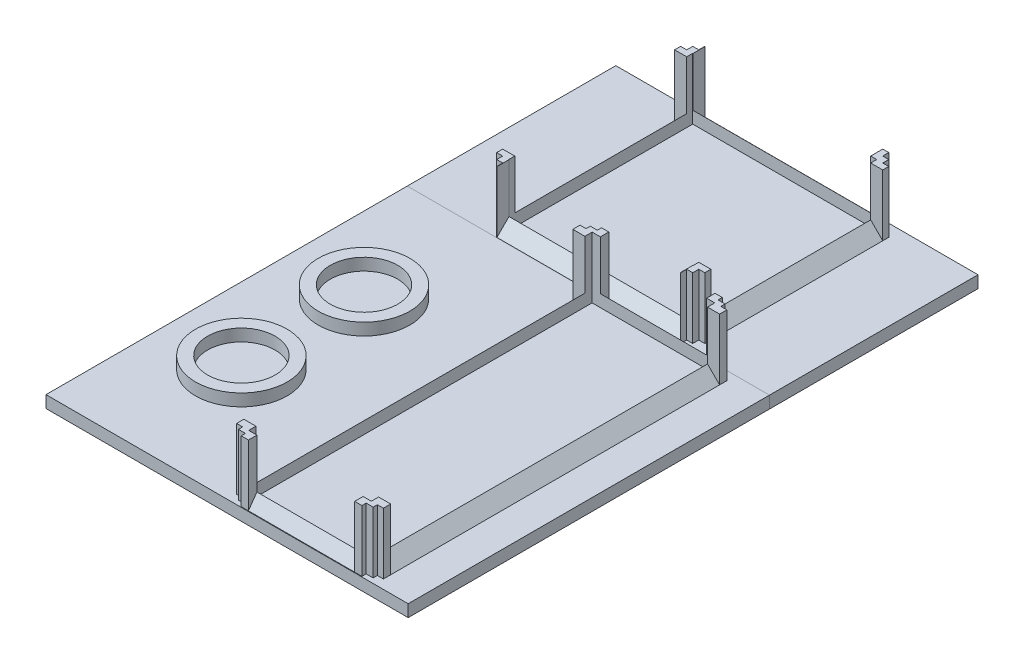
from build123d import *

# Parameters (mm, degrees)
OUTLINE_W                    = 75
OUTLINE_H                    = 236
THE_FLOOR_DEPTH              = 5
CABINET_SIDE_RESTRAINT_DEPTH = 76.2
BOSS_EXTRUDE7_DEPTH          = 38
BOSS_EXTRUDE15_DEPTH         = 25.4
SIDE_RESTRAINTS_DEPTH        = 71.12
SKETCH17_W                   = 5
SKETCH17_H                   = 5
BOSS_EXTRUDE16_DEPTH         = 25
BOSS_EXTRUDE17_REACH         = 144.106
SKETCH24_W                   = 5
SKETCH24_H                   = 3
SKETCH24_W_2                 = 3
SKETCH24_H_2                 = 3.5


# Read off the part's stored shape, not the designer's step: Boss-Extrude15
with BuildPart() as part:
    # outline → the floor (new body)
    with BuildSketch(Plane(origin=(0, 0, 0), x_dir=(1, 0, 0), z_dir=(0, 1, 0))):
        with Locations((37.5, 0)):
            Rectangle(OUTLINE_W, OUTLINE_H)
        with Locations((-37.5, 0)):
            Rectangle(OUTLINE_W, OUTLINE_H)
    extrude(amount=THE_FLOOR_DEPTH)

    # Sketch7 → cabinet side restraint (add)
    with BuildSketch(Plane.XY.offset(-36.75)):
        Polygon((-38.1, 5), (-38.1, 10), (-43.1, 5), align=None)
    cabinet_side_restraint = extrude(amount=-CABINET_SIDE_RESTRAINT_DEPTH)

    # Mirror1: cabinet side restraint across plane
    add(cabinet_side_restraint.mirror(Plane(origin=(0, 0, 0), x_dir=(0, 0, 1), z_dir=(1, 0, 0))))

    # Sketch9 → Boss-Extrude7 (add, symmetric)
    with BuildSketch(Plane(origin=(0, 0, 0), x_dir=(0, 0, -1), z_dir=(1, 0, 0))):
        Polygon((112.95, 5), (117.95, 5), (112.95, 10), align=None)
    boss_extrude7 = extrude(amount=BOSS_EXTRUDE7_DEPTH, both=True)

    # Mirror2: Boss-Extrude7 across plane
    add(boss_extrude7.mirror(Plane.XY.offset(-74.85)))

    # Boss-Extrude15 outline → Boss-Extrude15 (add)
    with BuildSketch(Plane(origin=(0, 5, 0), x_dir=(1, 0, 0), z_dir=(0, 1, 0))):
        Polygon((38.1, 112.95), (38.1, 110.45), (43.1, 110.45), (43.1, 112.95), (40.6, 112.95), (40.6, 115.45), (38.1, 115.45), (38.1, 117.95), (35.6, 117.95), (35.6, 112.95), align=None)
        Polygon((43.1, 39.25), (38.1, 39.25), (38.1, 36.75), (38, 36.75), (38, 31.75), (38.1, 31.75), (38.1, 34.25), (40.6, 34.25), (40.6, 36.75), (43.1, 36.75), align=None)
        Polygon((-38.1, 112.95), (-38, 112.95), (-38, 117.95), (-38.1, 117.95), (-38.1, 115.45), (-40.6, 115.45), (-40.6, 112.95), (-43.1, 112.95), (-43.1, 110.45), (-38.1, 110.45), align=None)
        Polygon((-38, 31.75), (-38, 36.75), (-38.1, 36.75), (-38.1, 39.25), (-43.1, 39.25), (-43.1, 36.75), (-40.6, 36.75), (-40.6, 34.25), (-38.1, 34.25), (-38.1, 31.75), align=None)
    extrude(amount=BOSS_EXTRUDE15_DEPTH)

    # Sketch12 → side restraints (add, symmetric)
    with BuildSketch(Plane.XY.offset(43.13)):
        Polygon((0.197497467, 5), (5.197497467, 5), (5.197497467, 10), align=None)
    side_restraints = extrude(amount=SIDE_RESTRAINTS_DEPTH, both=True)

    # restraint mirror: side restraints across plane
    add(side_restraints.mirror(Plane(origin=(30.597497467, 0, 0), x_dir=(0, 0, 1), z_dir=(1, 0, 0))))

    # Sketch17 → Revolve1 (revolve)
    with BuildSketch(Plane.XY.offset(17.73), mode=Mode.PRIVATE) as revolve1_sk:
        with Locations((-60.023321963, 7.5)):
            Rectangle(SKETCH17_W, SKETCH17_H)
    revolve1 = revolve(revolve1_sk.sketch.rotate(Axis((-43.553321963, 5, 17.73), (0, 1, 0)), 270), axis=Axis((-43.553321963, 5, 17.73), (0, 1, 0)))

    # Mirror7: Revolve1 across plane
    add(revolve1.mirror(Plane.XY.offset(43.13)))

    # Sketch23 → Boss-Extrude16 (add, symmetric)
    with BuildSketch(Plane(origin=(30.597497467, 0, 0), x_dir=(0, 0, -1), z_dir=(1, 0, 0))):
        Polygon((27.99, 5), (27.99, 10), (31.49, 5), align=None)
    boss_extrude16 = extrude(amount=BOSS_EXTRUDE16_DEPTH, both=True)

    # Mirror10: Boss-Extrude16 across plane
    add(boss_extrude16.mirror(Plane.XY.offset(43.13)))

    # Boss-Extrude17: up to this face of the body (flat: up to its plane)
    boss_extrude17_end = Plane(part.part.faces().sort_by_distance((-40.127922078, 30.4, -37.090909091))[0])
    # Sketch24 → Boss-Extrude17 (add, up to the picked face)
    with BuildSketch(Plane(origin=(0, 5, 0), x_dir=(1, 0, 0), z_dir=(0, 1, 0)), mode=Mode.PRIVATE) as boss_extrude17_sk1:
        with Locations((2.697497467, 26.49)):
            Rectangle(SKETCH24_W, SKETCH24_H)
    boss_extrude17_tool1 = split(extrude(boss_extrude17_sk1.sketch, amount=BOSS_EXTRUDE17_REACH, mode=Mode.PRIVATE), bisect_by=boss_extrude17_end, keep=Keep.BOTH, mode=Mode.PRIVATE)
    # Sketch24 → Boss-Extrude17 (add, up to the picked face)
    with BuildSketch(Plane(origin=(0, 5, 0), x_dir=(1, 0, 0), z_dir=(0, 1, 0)), mode=Mode.PRIVATE) as boss_extrude17_sk2:
        Polygon((5.597497467, 27.99), (5.597497467, 29.74), (2.697497467, 29.74), (2.697497467, 27.99), (5.197497467, 27.99), align=None)
    boss_extrude17_tool2 = split(extrude(boss_extrude17_sk2.sketch, amount=BOSS_EXTRUDE17_REACH, mode=Mode.PRIVATE), bisect_by=boss_extrude17_end, keep=Keep.BOTH, mode=Mode.PRIVATE)
    # Sketch24 → Boss-Extrude17 (add, up to the picked face)
    with BuildSketch(Plane(origin=(0, 5, 0), x_dir=(1, 0, 0), z_dir=(0, 1, 0)), mode=Mode.PRIVATE) as boss_extrude17_sk3:
        with Locations((7.097497467, 29.74)):
            Rectangle(SKETCH24_W_2, SKETCH24_H_2)
    boss_extrude17_tool3 = split(extrude(boss_extrude17_sk3.sketch, amount=BOSS_EXTRUDE17_REACH, mode=Mode.PRIVATE), bisect_by=boss_extrude17_end, keep=Keep.BOTH, mode=Mode.PRIVATE)
    # Sketch24 → Boss-Extrude17 (add, up to the picked face)
    with BuildSketch(Plane(origin=(0, 5, 0), x_dir=(1, 0, 0), z_dir=(0, 1, 0)), mode=Mode.PRIVATE) as boss_extrude17_sk4:
        with Locations((54.097497467, 29.74)):
            Rectangle(SKETCH24_W_2, SKETCH24_H_2)
    boss_extrude17_tool4 = split(extrude(boss_extrude17_sk4.sketch, amount=BOSS_EXTRUDE17_REACH, mode=Mode.PRIVATE), bisect_by=boss_extrude17_end, keep=Keep.BOTH, mode=Mode.PRIVATE)
    # Sketch24 → Boss-Extrude17 (add, up to the picked face)
    with BuildSketch(Plane(origin=(0, 5, 0), x_dir=(1, 0, 0), z_dir=(0, 1, 0)), mode=Mode.PRIVATE) as boss_extrude17_sk5:
        Polygon((55.597497467, 29.74), (55.597497467, 27.99), (55.997497467, 27.99), (58.497497467, 27.99), (58.497497467, 29.74), align=None)
    boss_extrude17_tool5 = split(extrude(boss_extrude17_sk5.sketch, amount=BOSS_EXTRUDE17_REACH, mode=Mode.PRIVATE), bisect_by=boss_extrude17_end, keep=Keep.BOTH, mode=Mode.PRIVATE)
    # Sketch24 → Boss-Extrude17 (add, up to the picked face)
    with BuildSketch(Plane(origin=(0, 5, 0), x_dir=(1, 0, 0), z_dir=(0, 1, 0)), mode=Mode.PRIVATE) as boss_extrude17_sk6:
        with Locations((58.497497467, 26.49)):
            Rectangle(SKETCH24_W, SKETCH24_H)
    boss_extrude17_tool6 = split(extrude(boss_extrude17_sk6.sketch, amount=BOSS_EXTRUDE17_REACH, mode=Mode.PRIVATE), bisect_by=boss_extrude17_end, keep=Keep.BOTH, mode=Mode.PRIVATE)
    # Sketch24 → Boss-Extrude17 (add, up to the picked face)
    with BuildSketch(Plane(origin=(0, 5, 0), x_dir=(1, 0, 0), z_dir=(0, 1, 0)), mode=Mode.PRIVATE) as boss_extrude17_sk7:
        with Locations((58.497497467, -112.75)):
            Rectangle(SKETCH24_W, SKETCH24_H)
    boss_extrude17_tool7 = split(extrude(boss_extrude17_sk7.sketch, amount=BOSS_EXTRUDE17_REACH, mode=Mode.PRIVATE), bisect_by=boss_extrude17_end, keep=Keep.BOTH, mode=Mode.PRIVATE)
    # Sketch24 → Boss-Extrude17 (add, up to the picked face)
    with BuildSketch(Plane(origin=(0, 5, 0), x_dir=(1, 0, 0), z_dir=(0, 1, 0)), mode=Mode.PRIVATE) as boss_extrude17_sk8:
        Polygon((55.997497467, -114.25), (55.597497467, -114.25), (55.597497467, -116), (58.497497467, -116), (58.497497467, -114.25), align=None)
    boss_extrude17_tool8 = split(extrude(boss_extrude17_sk8.sketch, amount=BOSS_EXTRUDE17_REACH, mode=Mode.PRIVATE), bisect_by=boss_extrude17_end, keep=Keep.BOTH, mode=Mode.PRIVATE)
    # Sketch24 → Boss-Extrude17 (add, up to the picked face)
    with BuildSketch(Plane(origin=(0, 5, 0), x_dir=(1, 0, 0), z_dir=(0, 1, 0)), mode=Mode.PRIVATE) as boss_extrude17_sk9:
        with Locations((54.097497467, -116)):
            Rectangle(SKETCH24_W_2, SKETCH24_H_2)
    boss_extrude17_tool9 = split(extrude(boss_extrude17_sk9.sketch, amount=BOSS_EXTRUDE17_REACH, mode=Mode.PRIVATE), bisect_by=boss_extrude17_end, keep=Keep.BOTH, mode=Mode.PRIVATE)
    # Sketch24 → Boss-Extrude17 (add, up to the picked face)
    with BuildSketch(Plane(origin=(0, 5, 0), x_dir=(1, 0, 0), z_dir=(0, 1, 0)), mode=Mode.PRIVATE) as boss_extrude17_sk10:
        with Locations((7.097497467, -116)):
            Rectangle(SKETCH24_W_2, SKETCH24_H_2)
    boss_extrude17_tool10 = split(extrude(boss_extrude17_sk10.sketch, amount=BOSS_EXTRUDE17_REACH, mode=Mode.PRIVATE), bisect_by=boss_extrude17_end, keep=Keep.BOTH, mode=Mode.PRIVATE)
    # Sketch24 → Boss-Extrude17 (add, up to the picked face)
    with BuildSketch(Plane(origin=(0, 5, 0), x_dir=(1, 0, 0), z_dir=(0, 1, 0)), mode=Mode.PRIVATE) as boss_extrude17_sk11:
        Polygon((5.597497467, -116), (5.597497467, -114.25), (5.197497467, -114.25), (2.697497467, -114.25), (2.697497467, -116), align=None)
    boss_extrude17_tool11 = split(extrude(boss_extrude17_sk11.sketch, amount=BOSS_EXTRUDE17_REACH, mode=Mode.PRIVATE), bisect_by=boss_extrude17_end, keep=Keep.BOTH, mode=Mode.PRIVATE)
    # Sketch24 → Boss-Extrude17 (add, up to the picked face)
    with BuildSketch(Plane(origin=(0, 5, 0), x_dir=(1, 0, 0), z_dir=(0, 1, 0)), mode=Mode.PRIVATE) as boss_extrude17_sk12:
        with Locations((2.697497467, -112.75)):
            Rectangle(SKETCH24_W, SKETCH24_H)
    boss_extrude17_tool12 = split(extrude(boss_extrude17_sk12.sketch, amount=BOSS_EXTRUDE17_REACH, mode=Mode.PRIVATE), bisect_by=boss_extrude17_end, keep=Keep.BOTH, mode=Mode.PRIVATE)
    add(boss_extrude17_tool1.solids().sort_by(Axis((2.697497, 5, -26.49), (0, 1, 0)))[0])
    add(boss_extrude17_tool2.solids().sort_by(Axis((4.147497, 5, -28.865), (0, 1, 0)))[0])
    add(boss_extrude17_tool3.solids().sort_by(Axis((7.097497, 5, -29.74), (0, 1, 0)))[0])
    add(boss_extrude17_tool4.solids().sort_by(Axis((54.097497, 5, -29.74), (0, 1, 0)))[0])
    add(boss_extrude17_tool5.solids().sort_by(Axis((57.047497, 5, -28.865), (0, 1, 0)))[0])
    add(boss_extrude17_tool6.solids().sort_by(Axis((58.497497, 5, -26.49), (0, 1, 0)))[0])
    add(boss_extrude17_tool7.solids().sort_by(Axis((58.497497, 5, 112.75), (0, 1, 0)))[0])
    add(boss_extrude17_tool8.solids().sort_by(Axis((57.047497, 5, 115.125), (0, 1, 0)))[0])
    add(boss_extrude17_tool9.solids().sort_by(Axis((54.097497, 5, 116), (0, 1, 0)))[0])
    add(boss_extrude17_tool10.solids().sort_by(Axis((7.097497, 5, 116), (0, 1, 0)))[0])
    add(boss_extrude17_tool11.solids().sort_by(Axis((4.147497, 5, 115.125), (0, 1, 0)))[0])
    add(boss_extrude17_tool12.solids().sort_by(Axis((2.697497, 5, 112.75), (0, 1, 0)))[0])


with BuildPart() as body_2:
    # Split1: the piece on the far side of the plane
    add(part.part)
    split(bisect_by=Plane(origin=(0, 0, -31.62), x_dir=(-1, 0, 0), z_dir=(0, 0, -1)), keep=Keep.BOTTOM)


with BuildPart() as part_1:
    add(part.part)

    # Split1
    split(bisect_by=Plane(origin=(0, 0, -31.62), x_dir=(-1, 0, 0), z_dir=(0, 0, -1)), keep=Keep.TOP)


solid = Compound([body_2.part, part_1.part])
